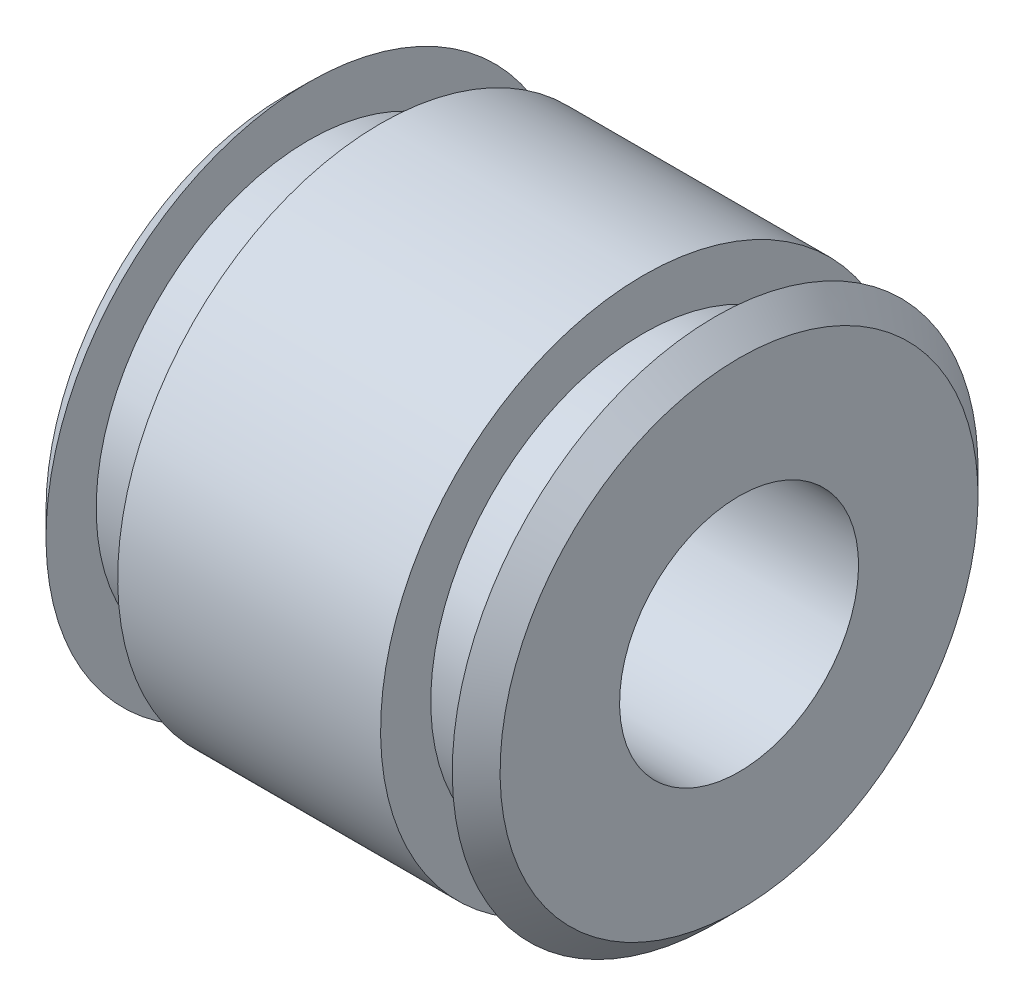
from build123d import *

# Parameters (mm, degrees)
SCHIZZO2_R               = 5
TAGLIO_ESTRUSIONE1_DEPTH = 16
SMUSSO1_SIZE             = 1


with BuildPart() as part:
    # Schizzo1 → Rivoluzione1 (revolve)
    with BuildSketch(Plane.XY):
        Polygon((0, 0), (0, 11), (1, 11), (1, 8.9), (4, 8.9), (4, 11), (15, 11), (15, 8.9), (18, 8.9), (18, 11), (19, 11), (19, 0), align=None)
    revolve(axis=Axis((19, 0, 0), (-1, 0, 0)))

    # Schizzo2 → Taglio-Estrusione1 (cut)
    with BuildSketch(Plane(origin=(19, 0, 0), x_dir=(0, 0, -1), z_dir=(1, 0, 0))):
        with Locations(Location((0, 0, 0), (0, 0, 90))):
            Circle(SCHIZZO2_R)
    extrude(amount=-TAGLIO_ESTRUSIONE1_DEPTH, mode=Mode.SUBTRACT)

    # Smusso1
    smusso1_edges = [part.edges().sort_by_distance(p)[0] for p in [
        (0, -11, 0),
        (19, -11, 0),
    ]]
    chamfer(smusso1_edges, length=SMUSSO1_SIZE - 0.0001)  # a hair under: the kernel refuses the full size


solid = part.part
